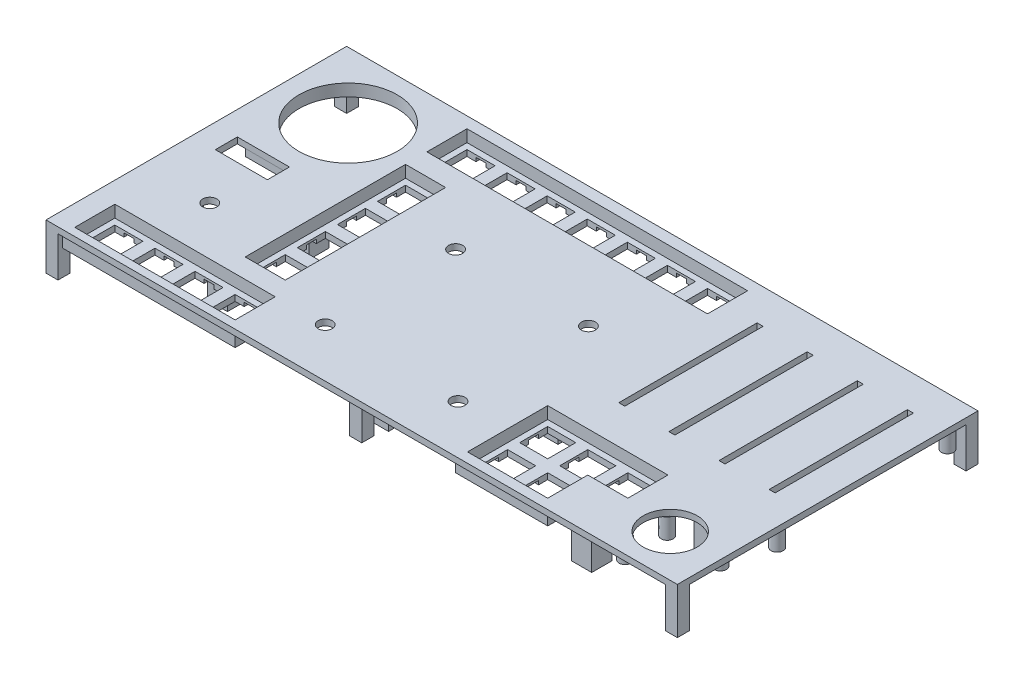
from build123d import *

# Parameters (mm, degrees)
SKETCH2_W               = 315
SKETCH2_H               = 150
BOSS_EXTRUDE1_DEPTH     = 3
SKETCH28_R              = 3.5
CUT_EXTRUDE15_DEPTH     = 10
SKETCH29_W              = 5
SKETCH29_H              = 5
SKETCH29_R              = 1.6
BOSS_EXTRUDE15_DEPTH    = 6.5
SKETCH9_W               = 146
SKETCH9_H               = 26
SKETCH9_W_2             = 26
SKETCH9_H_2             = 88.404657475
SKETCH9_W_3             = 86
BOSS_EXTRUDE5_DEPTH     = 6
CUT_EXTRUDE8_DEPTH      = 3
CUT_EXTRUDE8_DEPTH_BACK = 3
SKETCH11_W              = 140
SKETCH11_H              = 20
SKETCH11_W_2            = 20
SKETCH11_H_2            = 80
SKETCH11_W_3            = 80
SKETCH5_W               = 14
SKETCH5_H               = 14
CUT_EXTRUDE3_DEPTH      = 10
SKETCH6_W               = 5
SKETCH6_H               = 20
SKETCH6_W_2             = 20
SKETCH6_H_2             = 5
SKETCH6_W_3             = 60
SKETCH6_W_4             = 40
CUT_EXTRUDE4_DEPTH      = 1.9
SKETCH7_W               = 3
SKETCH7_H               = 69
CUT_EXTRUDE5_DEPTH      = 3
SKETCH8_R               = 3
SKETCH8_R_2             = 1.6
BOSS_EXTRUDE3_DEPTH     = 12
SKETCH13_W              = 26
SKETCH13_H              = 11
CUT_EXTRUDE9_DEPTH      = 10
SKETCH14_W              = 18.818663997
SKETCH14_H              = 2
BOSS_EXTRUDE7_DEPTH     = 4
SKETCH25_R              = 24.5
CUT_EXTRUDE13_DEPTH     = 3
SKETCH26_R              = 29
SKETCH26_R_2            = 1.6
SKETCH26_R_3            = 24
BOSS_EXTRUDE14_DEPTH    = 3
SKETCH27_R              = 24.5
CUT_EXTRUDE14_DEPTH     = 10
SKETCH21_W              = 45.276529112
SKETCH21_H              = 2
TEENSY4_1_DEPTH         = 8
SKETCH22_R              = 13.5
CUT_EXTRUDE12_DEPTH     = 8
SKETCH23_R              = 3
SKETCH23_R_2            = 1.6
BOSS_EXTRUDE12_DEPTH    = 10
SKETCH24_W              = 6
SKETCH24_H              = 6
SKETCH24_R              = 1.6
SKETCH24_W_2            = 10
SKETCH24_H_2            = 10
SKETCH24_R_2            = 3
SKETCH24_W_3            = 10.000000001
HOLDERS_DEPTH           = 20


with BuildPart() as part:
    # Sketch2 → Boss-Extrude1 (new body)
    with BuildSketch(Plane(origin=(0, 0, 0), x_dir=(1, 0, 0), z_dir=(0, 1, 0))):
        with Locations((157.5, 75)):
            Rectangle(SKETCH2_W, SKETCH2_H)
    extrude(amount=BOSS_EXTRUDE1_DEPTH)

    # Sketch28 → Cut-Extrude15 (cut)
    with BuildSketch(Plane(origin=(0, 0, 0), x_dir=(1, 0, 0), z_dir=(0, 1, 0))):
        with Locations((114.90713646, 89.450021392)):
            Circle(SKETCH28_R)
        with Locations((181.175523189, 89.450021392)):
            Circle(SKETCH28_R)
        with Locations((181.175523189, 24.378291247)):
            Circle(SKETCH28_R)
        with Locations((114.90713646, 24.378291247)):
            Circle(SKETCH28_R)
        with Locations((33.520813033, 48.196238819)):
            Circle(SKETCH28_R)
    extrude(amount=CUT_EXTRUDE15_DEPTH, mode=Mode.SUBTRACT)

    # Sketch29 → Boss-Extrude15 (add)
    # profile 1 of 10: a face of its own
    with BuildSketch(Plane(origin=(0, 0, 0), x_dir=(1, 0, 0), z_dir=(0, 1, 0))):
        with Locations((125.56713646, 80.950021392)):
            Rectangle(SKETCH29_W, SKETCH29_H)
        with Locations((125.56713646, 80.950021392)):
            Circle(SKETCH29_R, mode=Mode.SUBTRACT)
    # profile 2 of 10: a face of its own
    with BuildSketch(Plane(origin=(0, 0, 0), x_dir=(1, 0, 0), z_dir=(0, 1, 0))):
        with Locations((108.56713646, 80.950021392)):
            Rectangle(SKETCH29_W, SKETCH29_H)
        with Locations((108.56713646, 80.950021392)):
            Circle(SKETCH29_R, mode=Mode.SUBTRACT)
    # profile 3 of 10: a face of its own
    with BuildSketch(Plane(origin=(0, 0, 0), x_dir=(1, 0, 0), z_dir=(0, 1, 0))):
        with Locations((190.753782515, 79.985312234)):
            Rectangle(SKETCH29_W, SKETCH29_H)
        with Locations((190.753782515, 79.985312234)):
            Circle(SKETCH29_R, mode=Mode.SUBTRACT)
    # profile 4 of 10: a face of its own
    with BuildSketch(Plane(origin=(0, 0, 0), x_dir=(1, 0, 0), z_dir=(0, 1, 0))):
        with Locations((173.753782515, 79.985312234)):
            Rectangle(SKETCH29_W, SKETCH29_H)
        with Locations((173.753782515, 79.985312234)):
            Circle(SKETCH29_R, mode=Mode.SUBTRACT)
    # profile 5 of 10: a face of its own
    with BuildSketch(Plane(origin=(0, 0, 0), x_dir=(1, 0, 0), z_dir=(0, 1, 0))):
        with Locations((191.835523189, 15.878291247)):
            Rectangle(SKETCH29_W, SKETCH29_H)
        with Locations((191.835523189, 15.878291247)):
            Circle(SKETCH29_R, mode=Mode.SUBTRACT)
    # profile 6 of 10: a face of its own
    with BuildSketch(Plane(origin=(0, 0, 0), x_dir=(1, 0, 0), z_dir=(0, 1, 0))):
        with Locations((174.835523189, 15.878291247)):
            Rectangle(SKETCH29_W, SKETCH29_H)
        with Locations((174.835523189, 15.878291247)):
            Circle(SKETCH29_R, mode=Mode.SUBTRACT)
    # profile 7 of 10: a face of its own
    with BuildSketch(Plane(origin=(0, 0, 0), x_dir=(1, 0, 0), z_dir=(0, 1, 0))):
        with Locations((125.56713646, 15.878291247)):
            Rectangle(SKETCH29_W, SKETCH29_H)
        with Locations((125.56713646, 15.878291247)):
            Circle(SKETCH29_R, mode=Mode.SUBTRACT)
    # profile 8 of 10: a face of its own
    with BuildSketch(Plane(origin=(0, 0, 0), x_dir=(1, 0, 0), z_dir=(0, 1, 0))):
        with Locations((108.56713646, 15.878291247)):
            Rectangle(SKETCH29_W, SKETCH29_H)
        with Locations((108.56713646, 15.878291247)):
            Circle(SKETCH29_R, mode=Mode.SUBTRACT)
    # profile 9 of 10: a face of its own
    with BuildSketch(Plane(origin=(0, 0, 0), x_dir=(1, 0, 0), z_dir=(0, 1, 0))):
        with Locations((44.180813033, 39.696238819)):
            Rectangle(SKETCH29_W, SKETCH29_H)
        with Locations((44.180813033, 39.696238819)):
            Circle(SKETCH29_R, mode=Mode.SUBTRACT)
    # profile 10 of 10: a face of its own
    with BuildSketch(Plane(origin=(0, 0, 0), x_dir=(1, 0, 0), z_dir=(0, 1, 0))):
        with Locations((27.180813033, 39.696238819)):
            Rectangle(SKETCH29_W, SKETCH29_H)
        with Locations((27.180813033, 39.696238819)):
            Circle(SKETCH29_R, mode=Mode.SUBTRACT)
    extrude(amount=-BOSS_EXTRUDE15_DEPTH)

    # Sketch9 → Boss-Extrude5 (add)
    with BuildSketch(Plane(origin=(0, 0, 0), x_dir=(1, 0, 0), z_dir=(0, 1, 0))):
        with Locations((135.62507115, 134.415430031)):
            Rectangle(SKETCH9_W, SKETCH9_H)
        with Locations((75.687957304, 72.494217631)):
            Rectangle(SKETCH9_W_2, SKETCH9_H_2)
        with Locations((50.384312454, 13.969400829)):
            Rectangle(SKETCH9_W_3, SKETCH9_H)
        Polygon((202.389470698, 47.923211811), (202.389470698, 1.923211811), (248.389470698, 1.923211811), (248.389470698, 21.923211811), (268.389470698, 21.923211811), (268.389470698, 47.923211811), align=None)
    extrude(amount=-BOSS_EXTRUDE5_DEPTH)

    # Sketch11 → Cut-Extrude8 (cut, two sides: drawn at the far end of the back side and taken through both)
    with BuildSketch(Plane(origin=(0, 0, 0), x_dir=(1, 0, 0), z_dir=(0, 1, 0)).offset(-CUT_EXTRUDE8_DEPTH_BACK)):
        Polygon((205.389470698, 44.923211811), (205.389470698, 4.923211811), (245.389470698, 4.923211811), (245.389470698, 24.923211811), (265.389470698, 24.923211811), (265.389470698, 44.923211811), align=None)
        with Locations((135.62507115, 134.415430031)):
            Rectangle(SKETCH11_W, SKETCH11_H)
        with Locations((75.687957304, 73.696546368)):
            Rectangle(SKETCH11_W_2, SKETCH11_H_2)
        with Locations((50.384312454, 13.969400829)):
            Rectangle(SKETCH11_W_3, SKETCH11_H)
    extrude(amount=CUT_EXTRUDE8_DEPTH + CUT_EXTRUDE8_DEPTH_BACK, mode=Mode.SUBTRACT)

    # Sketch5 → Cut-Extrude3 (cut, symmetric)
    with BuildSketch(Plane(origin=(0, 0, 0), x_dir=(1, 0, 0), z_dir=(0, 1, 0))):
        with Locations((75.62507115, 134.415430031)):
            Rectangle(SKETCH5_W, SKETCH5_H)
        with Locations((95.62507115, 134.415430031)):
            Rectangle(SKETCH5_W, SKETCH5_H)
        with Locations((115.62507115, 134.415430031)):
            Rectangle(SKETCH5_W, SKETCH5_H)
        with Locations((135.62507115, 134.415430031)):
            Rectangle(SKETCH5_W, SKETCH5_H)
        with Locations((155.62507115, 134.415430031)):
            Rectangle(SKETCH5_W, SKETCH5_H)
        with Locations((175.62507115, 134.415430031)):
            Rectangle(SKETCH5_W, SKETCH5_H)
        with Locations((195.62507115, 134.415430031)):
            Rectangle(SKETCH5_W, SKETCH5_H)
        with Locations((75.687957304, 103.696546368)):
            Rectangle(SKETCH5_W, SKETCH5_H)
        with Locations((75.687957304, 83.696546368)):
            Rectangle(SKETCH5_W, SKETCH5_H)
        with Locations((75.687957304, 63.696546368)):
            Rectangle(SKETCH5_W, SKETCH5_H)
        with Locations((75.687957304, 43.696546368)):
            Rectangle(SKETCH5_W, SKETCH5_H)
        with Locations((20.384312454, 13.969400829)):
            Rectangle(SKETCH5_W, SKETCH5_H)
        with Locations((40.384312454, 13.969400829)):
            Rectangle(SKETCH5_W, SKETCH5_H)
        with Locations((60.384312454, 13.969400829)):
            Rectangle(SKETCH5_W, SKETCH5_H)
        with Locations((80.384312454, 13.969400829)):
            Rectangle(SKETCH5_W, SKETCH5_H)
        with Locations((255.389470698, 34.923211811)):
            Rectangle(SKETCH5_W, SKETCH5_H)
        with Locations((235.389470698, 34.923211811)):
            Rectangle(SKETCH5_W, SKETCH5_H)
        with Locations((215.389470698, 34.923211811)):
            Rectangle(SKETCH5_W, SKETCH5_H)
        with Locations((215.389470698, 14.923211811)):
            Rectangle(SKETCH5_W, SKETCH5_H)
        with Locations((235.389470698, 14.923211811)):
            Rectangle(SKETCH5_W, SKETCH5_H)
    extrude(amount=CUT_EXTRUDE3_DEPTH, both=True, mode=Mode.SUBTRACT)

    # Sketch6 → Cut-Extrude4 (cut)
    with BuildSketch(Plane(origin=(0, -6, 0), x_dir=(1, 0, 0), z_dir=(0, 1, 0))):
        with Locations((20.384312454, 13.969400829)):
            Rectangle(SKETCH6_W, SKETCH6_H)
        with Locations((40.384312454, 13.969400829)):
            Rectangle(SKETCH6_W, SKETCH6_H)
        with Locations((60.384312454, 13.969400829)):
            Rectangle(SKETCH6_W, SKETCH6_H)
        with Locations((80.384312454, 13.969400829)):
            Rectangle(SKETCH6_W, SKETCH6_H)
        with Locations((75.62507115, 134.415430031)):
            Rectangle(SKETCH6_W, SKETCH6_H)
        with Locations((95.62507115, 134.415430031)):
            Rectangle(SKETCH6_W, SKETCH6_H)
        with Locations((115.62507115, 134.415430031)):
            Rectangle(SKETCH6_W, SKETCH6_H)
        with Locations((135.62507115, 134.415430031)):
            Rectangle(SKETCH6_W, SKETCH6_H)
        with Locations((155.62507115, 134.415430031)):
            Rectangle(SKETCH6_W, SKETCH6_H)
        with Locations((175.62507115, 134.415430031)):
            Rectangle(SKETCH6_W, SKETCH6_H)
        with Locations((195.62507115, 134.415430031)):
            Rectangle(SKETCH6_W, SKETCH6_H)
        with Locations((75.687957304, 103.696546368)):
            Rectangle(SKETCH6_W_2, SKETCH6_H_2)
        with Locations((75.687957304, 83.696546368)):
            Rectangle(SKETCH6_W_2, SKETCH6_H_2)
        with Locations((75.687957304, 63.696546368)):
            Rectangle(SKETCH6_W_2, SKETCH6_H_2)
        with Locations((75.687957304, 43.696546368)):
            Rectangle(SKETCH6_W_2, SKETCH6_H_2)
        with Locations((235.389470698, 34.923211811)):
            Rectangle(SKETCH6_W_3, SKETCH6_H_2)
        with Locations((225.389470698, 14.923211811)):
            Rectangle(SKETCH6_W_4, SKETCH6_H_2)
    extrude(amount=CUT_EXTRUDE4_DEPTH, mode=Mode.SUBTRACT)

    # Sketch7 → Cut-Extrude5 (cut)
    with BuildSketch(Plane(origin=(0, 0, 0), x_dir=(1, 0, 0), z_dir=(0, 1, 0))):
        with Locations((223.364460611, 98.415430031)):
            Rectangle(SKETCH7_W, SKETCH7_H)
        with Locations((248.364460611, 98.415430031)):
            Rectangle(SKETCH7_W, SKETCH7_H)
        with Locations((273.364460611, 98.415430031)):
            Rectangle(SKETCH7_W, SKETCH7_H)
        with Locations((298.364460611, 98.415430031)):
            Rectangle(SKETCH7_W, SKETCH7_H)
    extrude(amount=CUT_EXTRUDE5_DEPTH, mode=Mode.SUBTRACT)

    # Sketch8 → Boss-Extrude3 (add)
    # profile 1 of 16: a face of its own
    with BuildSketch(Plane(origin=(0, 0, 0), x_dir=(1, 0, 0), z_dir=(0, 1, 0))):
        with Locations((218.364460611, 140.915430031)):
            Circle(SKETCH8_R)
        with Locations((218.364460611, 140.915430031)):
            Circle(SKETCH8_R_2, mode=Mode.SUBTRACT)
    # profile 2 of 16: a face of its own
    with BuildSketch(Plane(origin=(0, 0, 0), x_dir=(1, 0, 0), z_dir=(0, 1, 0))):
        with Locations((233.864460611, 140.915430031)):
            Circle(SKETCH8_R)
        with Locations((233.864460611, 140.915430031)):
            Circle(SKETCH8_R_2, mode=Mode.SUBTRACT)
    # profile 3 of 16: a face of its own
    with BuildSketch(Plane(origin=(0, 0, 0), x_dir=(1, 0, 0), z_dir=(0, 1, 0))):
        with Locations((243.364460611, 140.915430031)):
            Circle(SKETCH8_R)
        with Locations((243.364460611, 140.915430031)):
            Circle(SKETCH8_R_2, mode=Mode.SUBTRACT)
    # profile 4 of 16: a face of its own
    with BuildSketch(Plane(origin=(0, 0, 0), x_dir=(1, 0, 0), z_dir=(0, 1, 0))):
        with Locations((258.864460611, 140.915430031)):
            Circle(SKETCH8_R)
        with Locations((258.864460611, 140.915430031)):
            Circle(SKETCH8_R_2, mode=Mode.SUBTRACT)
    # profile 5 of 16: a face of its own
    with BuildSketch(Plane(origin=(0, 0, 0), x_dir=(1, 0, 0), z_dir=(0, 1, 0))):
        with Locations((268.364460611, 140.915430031)):
            Circle(SKETCH8_R)
        with Locations((268.364460611, 140.915430031)):
            Circle(SKETCH8_R_2, mode=Mode.SUBTRACT)
    # profile 6 of 16: a face of its own
    with BuildSketch(Plane(origin=(0, 0, 0), x_dir=(1, 0, 0), z_dir=(0, 1, 0))):
        with Locations((283.864460611, 140.915430031)):
            Circle(SKETCH8_R)
        with Locations((283.864460611, 140.915430031)):
            Circle(SKETCH8_R_2, mode=Mode.SUBTRACT)
    # profile 7 of 16: a face of its own
    with BuildSketch(Plane(origin=(0, 0, 0), x_dir=(1, 0, 0), z_dir=(0, 1, 0))):
        with Locations((293.364460611, 140.915430031)):
            Circle(SKETCH8_R)
        with Locations((293.364460611, 140.915430031)):
            Circle(SKETCH8_R_2, mode=Mode.SUBTRACT)
    # profile 8 of 16: a face of its own
    with BuildSketch(Plane(origin=(0, 0, 0), x_dir=(1, 0, 0), z_dir=(0, 1, 0))):
        with Locations((308.864460611, 140.915430031)):
            Circle(SKETCH8_R)
        with Locations((308.864460611, 140.915430031)):
            Circle(SKETCH8_R_2, mode=Mode.SUBTRACT)
    # profile 9 of 16: a face of its own
    with BuildSketch(Plane(origin=(0, 0, 0), x_dir=(1, 0, 0), z_dir=(0, 1, 0))):
        with Locations((308.864460611, 55.915430031)):
            Circle(SKETCH8_R)
        with Locations((308.864460611, 55.915430031)):
            Circle(SKETCH8_R_2, mode=Mode.SUBTRACT)
    # profile 10 of 16: a face of its own
    with BuildSketch(Plane(origin=(0, 0, 0), x_dir=(1, 0, 0), z_dir=(0, 1, 0))):
        with Locations((293.364460611, 55.915430031)):
            Circle(SKETCH8_R)
        with Locations((293.364460611, 55.915430031)):
            Circle(SKETCH8_R_2, mode=Mode.SUBTRACT)
    # profile 11 of 16: a face of its own
    with BuildSketch(Plane(origin=(0, 0, 0), x_dir=(1, 0, 0), z_dir=(0, 1, 0))):
        with Locations((283.864460611, 55.915430031)):
            Circle(SKETCH8_R)
        with Locations((283.864460611, 55.915430031)):
            Circle(SKETCH8_R_2, mode=Mode.SUBTRACT)
    # profile 12 of 16: a face of its own
    with BuildSketch(Plane(origin=(0, 0, 0), x_dir=(1, 0, 0), z_dir=(0, 1, 0))):
        with Locations((268.364460611, 55.915430031)):
            Circle(SKETCH8_R)
        with Locations((268.364460611, 55.915430031)):
            Circle(SKETCH8_R_2, mode=Mode.SUBTRACT)
    # profile 13 of 16: a face of its own
    with BuildSketch(Plane(origin=(0, 0, 0), x_dir=(1, 0, 0), z_dir=(0, 1, 0))):
        with Locations((258.864460611, 55.915430031)):
            Circle(SKETCH8_R)
        with Locations((258.864460611, 55.915430031)):
            Circle(SKETCH8_R_2, mode=Mode.SUBTRACT)
    # profile 14 of 16: a face of its own
    with BuildSketch(Plane(origin=(0, 0, 0), x_dir=(1, 0, 0), z_dir=(0, 1, 0))):
        with Locations((243.364460611, 55.915430031)):
            Circle(SKETCH8_R)
        with Locations((243.364460611, 55.915430031)):
            Circle(SKETCH8_R_2, mode=Mode.SUBTRACT)
    # profile 15 of 16: a face of its own
    with BuildSketch(Plane(origin=(0, 0, 0), x_dir=(1, 0, 0), z_dir=(0, 1, 0))):
        with Locations((233.864460611, 55.915430031)):
            Circle(SKETCH8_R)
        with Locations((233.864460611, 55.915430031)):
            Circle(SKETCH8_R_2, mode=Mode.SUBTRACT)
    # profile 16 of 16: a face of its own
    with BuildSketch(Plane(origin=(0, 0, 0), x_dir=(1, 0, 0), z_dir=(0, 1, 0))):
        with Locations((218.364460611, 55.915430031)):
            Circle(SKETCH8_R)
        with Locations((218.364460611, 55.915430031)):
            Circle(SKETCH8_R_2, mode=Mode.SUBTRACT)
    extrude(amount=-BOSS_EXTRUDE3_DEPTH)

    # Sketch13 → Cut-Extrude9 (cut)
    with BuildSketch(Plane(origin=(0, 0, 0), x_dir=(1, 0, 0), z_dir=(0, 1, 0))):
        with Locations((24.879289629, 78.093171669)):
            Rectangle(SKETCH13_W, SKETCH13_H)
    extrude(amount=CUT_EXTRUDE9_DEPTH, mode=Mode.SUBTRACT)

    # Sketch14 → Boss-Extrude7 (add)
    with BuildSketch(Plane(origin=(0, 0, 0), x_dir=(1, 0, 0), z_dir=(0, 1, 0))):
        with Locations((24.883088511, 85.110823052)):
            Rectangle(SKETCH14_W, SKETCH14_H)
        with Locations((24.883088511, 71.110823052)):
            Rectangle(SKETCH14_W, SKETCH14_H)
    extrude(amount=-BOSS_EXTRUDE7_DEPTH)

    # Sketch25 → Cut-Extrude13 (cut)
    with BuildSketch(Plane(origin=(0, 0, 0), x_dir=(1, 0, 0), z_dir=(0, 1, 0))):
        with Locations((33.520813033, 117.194974609)):
            Circle(SKETCH25_R)
    extrude(amount=CUT_EXTRUDE13_DEPTH, mode=Mode.SUBTRACT)

    # Sketch26 → Boss-Extrude14 (add)
    with BuildSketch(Plane.XZ):
        with Locations((33.520813033, -117.194974609)):
            Circle(SKETCH26_R)
        with Locations((10.571139832, -130.444974609)):
            Circle(SKETCH26_R_2, mode=Mode.SUBTRACT)
        with Locations((56.470486233, -130.444974609)):
            Circle(SKETCH26_R_2, mode=Mode.SUBTRACT)
        with Locations((33.520813033, -117.194974609)):
            Circle(SKETCH26_R_3, mode=Mode.SUBTRACT)
        with Locations((33.520813033, -90.694974609)):
            Circle(SKETCH26_R_2, mode=Mode.SUBTRACT)
    extrude(amount=BOSS_EXTRUDE14_DEPTH)

    # Sketch27 → Cut-Extrude14 (cut)
    with BuildSketch(Plane.XZ.offset(3)):
        with Locations((33.520813033, -117.194974609)):
            Circle(SKETCH27_R)
    extrude(amount=-CUT_EXTRUDE14_DEPTH, mode=Mode.SUBTRACT)

    # Sketch21 → Teensy4.1 (add)
    with BuildSketch(Plane(origin=(0, 0, 0), x_dir=(1, 0, 0), z_dir=(0, 1, 0))):
        with Locations((148.041329825, 66.91415632)):
            Rectangle(SKETCH21_W, SKETCH21_H)
        with Locations((148.041329825, 46.91415632)):
            Rectangle(SKETCH21_W, SKETCH21_H)
    extrude(amount=-TEENSY4_1_DEPTH)

    # Sketch22 → Cut-Extrude12 (cut)
    with BuildSketch(Plane(origin=(0, 0, 0), x_dir=(1, 0, 0), z_dir=(0, 1, 0))):
        with Locations((290.301841531, 21.139245559)):
            Circle(SKETCH22_R)
    extrude(amount=CUT_EXTRUDE12_DEPTH, mode=Mode.SUBTRACT)

    # Sketch23 → Boss-Extrude12 (add)
    # profile 1 of 4: a face of its own
    with BuildSketch(Plane(origin=(0, 0, 0), x_dir=(1, 0, 0), z_dir=(0, 1, 0))):
        with Locations((278.301841531, 31.639245559)):
            Circle(SKETCH23_R)
        with Locations((278.301841531, 31.639245559)):
            Circle(SKETCH23_R_2, mode=Mode.SUBTRACT)
    # profile 2 of 4: a face of its own
    with BuildSketch(Plane(origin=(0, 0, 0), x_dir=(1, 0, 0), z_dir=(0, 1, 0))):
        with Locations((304.801841531, 31.639245559)):
            Circle(SKETCH23_R)
        with Locations((304.801841531, 31.639245559)):
            Circle(SKETCH23_R_2, mode=Mode.SUBTRACT)
    # profile 3 of 4: a face of its own
    with BuildSketch(Plane(origin=(0, 0, 0), x_dir=(1, 0, 0), z_dir=(0, 1, 0))):
        with Locations((304.801841531, 10.639245559)):
            Circle(SKETCH23_R)
        with Locations((304.801841531, 10.639245559)):
            Circle(SKETCH23_R_2, mode=Mode.SUBTRACT)
    # profile 4 of 4: a face of its own
    with BuildSketch(Plane(origin=(0, 0, 0), x_dir=(1, 0, 0), z_dir=(0, 1, 0))):
        with Locations((278.301841531, 10.639245559)):
            Circle(SKETCH23_R)
        with Locations((278.301841531, 10.639245559)):
            Circle(SKETCH23_R_2, mode=Mode.SUBTRACT)
    extrude(amount=-BOSS_EXTRUDE12_DEPTH)

    # Sketch24 → holders (add)
    # profile 1 of 17: a face of its own
    with BuildSketch(Plane(origin=(0, 0, 0), x_dir=(1, 0, 0), z_dir=(0, 1, 0))):
        with Locations((3, 147)):
            Rectangle(SKETCH24_W, SKETCH24_H)
        with Locations((3, 147)):
            Circle(SKETCH24_R, mode=Mode.SUBTRACT)
    # profile 2 of 17: a face of its own
    with BuildSketch(Plane(origin=(0, 0, 0), x_dir=(1, 0, 0), z_dir=(0, 1, 0))):
        with Locations((3, 3)):
            Rectangle(SKETCH24_W, SKETCH24_H)
        with Locations((3, 3)):
            Circle(SKETCH24_R, mode=Mode.SUBTRACT)
    # profile 3 of 17: a face of its own
    with BuildSketch(Plane(origin=(0, 0, 0), x_dir=(1, 0, 0), z_dir=(0, 1, 0))):
        with Locations((160.584813344, 116.030051039)):
            Rectangle(SKETCH24_W, SKETCH24_H)
        with Locations((160.584813344, 116.030051039)):
            Circle(SKETCH24_R, mode=Mode.SUBTRACT)
    # profile 4 of 17: a face of its own
    with BuildSketch(Plane(origin=(0, 0, 0), x_dir=(1, 0, 0), z_dir=(0, 1, 0))):
        with Locations((148.852724672, 22.047319758)):
            Rectangle(SKETCH24_W_2, SKETCH24_H_2)
        with Locations((148.852724672, 22.047319758)):
            Circle(SKETCH24_R_2, mode=Mode.SUBTRACT)
    # profile 5 of 17: a face of its own
    with BuildSketch(Plane(origin=(0, 0, 0), x_dir=(1, 0, 0), z_dir=(0, 1, 0))):
        with Locations((149.108148483, 8.440789408)):
            Rectangle(SKETCH24_W, SKETCH24_H)
        with Locations((149.108148483, 8.440789408)):
            Circle(SKETCH24_R, mode=Mode.SUBTRACT)
    # profile 6 of 17: a face of its own
    with BuildSketch(Plane(origin=(0, 0, 0), x_dir=(1, 0, 0), z_dir=(0, 1, 0))):
        with Locations((108.244116471, 58.640246108)):
            Rectangle(SKETCH24_W_2, SKETCH24_H_2)
        with Locations((108.244116471, 58.640246108)):
            Circle(SKETCH24_R_2, mode=Mode.SUBTRACT)
    # profile 7 of 17: a face of its own
    with BuildSketch(Plane(origin=(0, 0, 0), x_dir=(1, 0, 0), z_dir=(0, 1, 0))):
        with Locations((312, 3)):
            Rectangle(SKETCH24_W, SKETCH24_H)
        with Locations((312, 3)):
            Circle(SKETCH24_R, mode=Mode.SUBTRACT)
    # profile 8 of 17: a face of its own
    with BuildSketch(Plane(origin=(0, 0, 0), x_dir=(1, 0, 0), z_dir=(0, 1, 0))):
        with Locations((312, 147)):
            Rectangle(SKETCH24_W, SKETCH24_H)
        with Locations((312, 147)):
            Circle(SKETCH24_R, mode=Mode.SUBTRACT)
    # profile 9 of 17: a face of its own
    with BuildSketch(Plane(origin=(0, 0, 0), x_dir=(1, 0, 0), z_dir=(0, 1, 0))):
        with Locations((54.760126517, 76.409830141)):
            Rectangle(SKETCH24_W_3, SKETCH24_H_2)
        with Locations((54.760126516, 76.409830141)):
            Circle(SKETCH24_R_2, mode=Mode.SUBTRACT)
    # profile 10 of 17: a face of its own
    with BuildSketch(Plane(origin=(0, 0, 0), x_dir=(1, 0, 0), z_dir=(0, 1, 0))):
        with Locations((56.888706053, 33.647880775)):
            Rectangle(SKETCH24_W_2, SKETCH24_H_2)
        with Locations((56.888706053, 33.647880775)):
            Circle(SKETCH24_R_2, mode=Mode.SUBTRACT)
    # profile 11 of 17: a face of its own
    with BuildSketch(Plane(origin=(0, 0, 0), x_dir=(1, 0, 0), z_dir=(0, 1, 0))):
        with Locations((6.687473524, 61.969040414)):
            Rectangle(SKETCH24_W_2, SKETCH24_H_2)
        with Locations((6.687473524, 61.969040414)):
            Circle(SKETCH24_R_2, mode=Mode.SUBTRACT)
    # profile 12 of 17: a face of its own
    with BuildSketch(Plane(origin=(0, 0, 0), x_dir=(1, 0, 0), z_dir=(0, 1, 0))):
        with Locations((105.328256476, 112.374037416)):
            Rectangle(SKETCH24_W_2, SKETCH24_H_2)
        with Locations((105.328256476, 112.374037416)):
            Circle(SKETCH24_R_2, mode=Mode.SUBTRACT)
    # profile 13 of 17: a face of its own
    with BuildSketch(Plane(origin=(0, 0, 0), x_dir=(1, 0, 0), z_dir=(0, 1, 0))):
        with Locations((196.731592235, 58.70008969)):
            Rectangle(SKETCH24_W_2, SKETCH24_H_2)
        with Locations((196.731592235, 58.70008969)):
            Circle(SKETCH24_R_2, mode=Mode.SUBTRACT)
    # profile 14 of 17: a face of its own
    with BuildSketch(Plane(origin=(0, 0, 0), x_dir=(1, 0, 0), z_dir=(0, 1, 0))):
        with Locations((260.487872979, 11.781843085)):
            Rectangle(SKETCH24_W_2, SKETCH24_H_2)
        with Locations((260.487872979, 11.781843085)):
            Circle(SKETCH24_R_2, mode=Mode.SUBTRACT)
    # profile 15 of 17: a face of its own
    with BuildSketch(Plane(origin=(0, 0, 0), x_dir=(1, 0, 0), z_dir=(0, 1, 0))):
        with Locations((290.058812632, 43.173516523)):
            Rectangle(SKETCH24_W_3, SKETCH24_H_2)
        with Locations((290.058812632, 43.173516523)):
            Circle(SKETCH24_R_2, mode=Mode.SUBTRACT)
    # profile 16 of 17: a face of its own
    with BuildSketch(Plane(origin=(0, 0, 0), x_dir=(1, 0, 0), z_dir=(0, 1, 0))):
        with Locations((148.295993654, 86.70517668)):
            Rectangle(SKETCH24_W_2, SKETCH24_H_2)
        with Locations((148.295993654, 86.70517668)):
            Circle(SKETCH24_R_2, mode=Mode.SUBTRACT)
    # profile 17 of 17: a face of its own
    with BuildSketch(Plane(origin=(0, 0, 0), x_dir=(1, 0, 0), z_dir=(0, 1, 0))):
        with Locations((206.112878642, 107.13858398)):
            Rectangle(SKETCH24_W_2, SKETCH24_H_2)
        with Locations((206.112878642, 107.13858398)):
            Circle(SKETCH24_R_2, mode=Mode.SUBTRACT)
    extrude(amount=-HOLDERS_DEPTH)


solid = part.part
